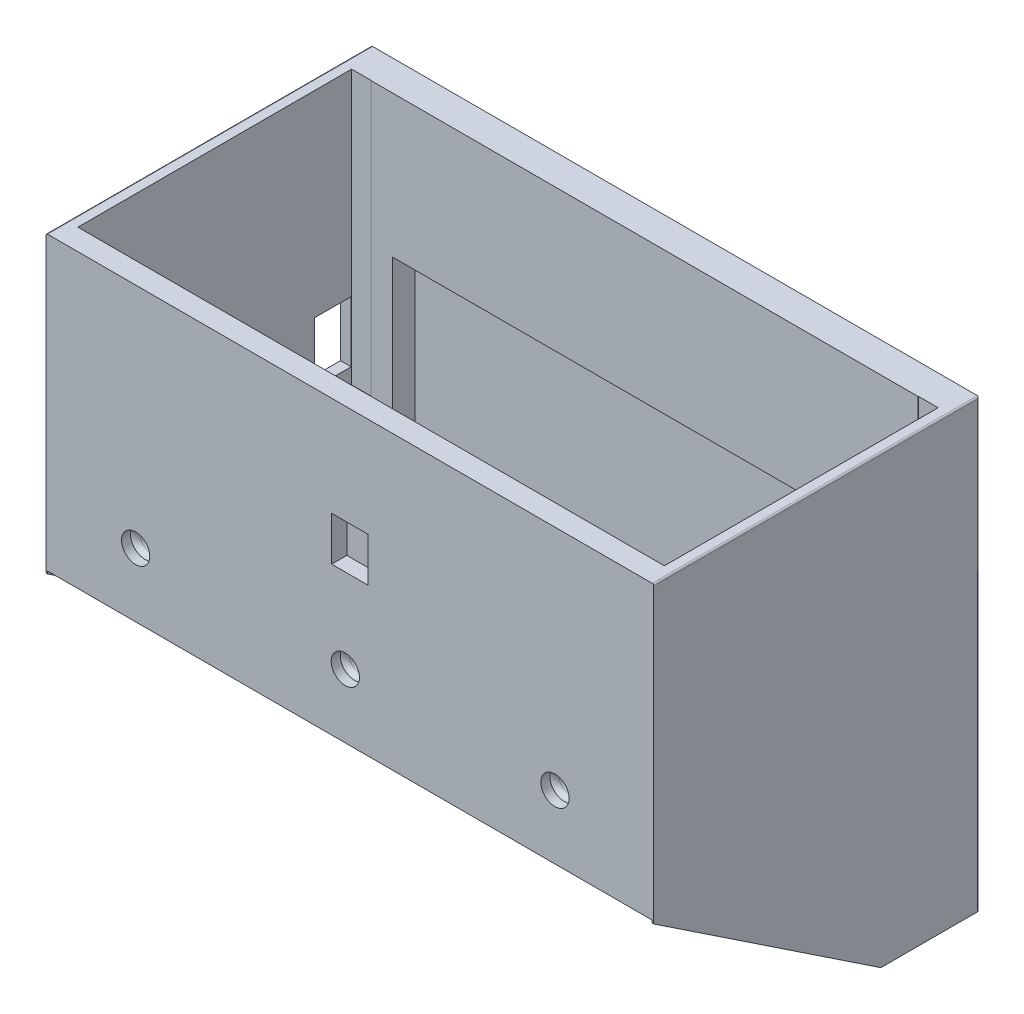
from build123d import *

# Parameters (mm, degrees)
SKETCH2_W           = 200
SKETCH2_H           = 150
BOSS_EXTRUDE1_DEPTH = 35
SKETCH3_W           = 200
SKETCH3_H           = 100
BOSS_EXTRUDE2_DEPTH = 75
LOFT3_START         = -100
LOFT3_DEPTH         = 200
SHELL2_T            = -10
SKETCH26_W          = 28.5
SKETCH26_H          = 31
CUT_EXTRUDE12_DEPTH = 15
SKETCH28_RX         = 8.1
SKETCH28_RY         = 7
CUT_EXTRUDE13_DEPTH = 9
SKETCH29_R          = 5
CUT_EXTRUDE14_DEPTH = 7.5
FILLET1_R           = 2
FILLET2_R           = 0.5
FILLET3_R           = 2
SKETCH30_R          = 1.75
CUT_EXTRUDE16_DEPTH = 10
SKETCH34_R          = 3.5
CUT_EXTRUDE18_DEPTH = 15
SKETCH34_3_R        = 4.65
SKETCH34_3_R_2      = 3.5
CUT_EXTRUDE19_DEPTH = 6
FILLET4_R           = 2
SKETCH35_W          = 166
SKETCH35_H          = 56.5
CUT_EXTRUDE20_DEPTH = 7.5
SKETCH6_W           = 30
SKETCH6_H           = 14
SKETCH6_H_2         = 7.591980562
SKETCH6_W_2         = 17
SKETCH6_H_3         = 9
CUT_EXTRUDE23_DEPTH = 15
CUT_EXTRUDE25_DEPTH = 8
SKETCH6_7_R         = 11
CUT_EXTRUDE26_DEPTH = 7.5
SKETCH6_8_W         = 30
SKETCH6_8_H         = 22.408019438
CUT_EXTRUDE27_DEPTH = 7
SKETCH6_9_W         = 17
SKETCH6_9_H         = 12
CUT_EXTRUDE28_DEPTH = 7
SKETCH6_10_W        = 12
SKETCH6_10_H        = 3.25
CUT_EXTRUDE29_DEPTH = 15
SKETCH46_W          = 12
SKETCH46_H          = 10.75
CUT_EXTRUDE31_DEPTH = 8
SKETCH46_5_W        = 12
SKETCH46_5_H        = 3.75
CUT_EXTRUDE32_DEPTH = 15
SKETCH47_W          = 12
SKETCH47_H          = 20
CUT_EXTRUDE33_DEPTH = 15
SKETCH49_W          = 199
SKETCH49_H          = 89.265638732
CUT_EXTRUDE34_DEPTH = 5
SKETCH56_W          = 199
SKETCH56_H          = 33.894448725
CUT_EXTRUDE37_DEPTH = 3
SKETCH48_W          = 28.075612318
SKETCH48_H          = 16
CUT_EXTRUDE38_DEPTH = 3
SKETCH57_W          = 6.5
SKETCH57_H          = 90.087623696
CUT_EXTRUDE39_DEPTH = 90
SKETCH69_W          = 228.232533895
SKETCH69_H          = 6
CUT_EXTRUDE44_DEPTH = 150
CUT_EXTRUDE46_DEPTH = 239.901653406
SKETCH72_W          = 67.134585738
SKETCH72_H          = 6.170384585
CUT_EXTRUDE48_DEPTH = 239.901653406


# Read off the part's stored shape, not the designer's step: Loft3
with BuildPart() as part:
    # Sketch2 → Boss-Extrude1 (new body)
    with BuildSketch(Plane.XY):
        Rectangle(SKETCH2_W, SKETCH2_H)
    extrude(amount=BOSS_EXTRUDE1_DEPTH)

    # Sketch3 → Boss-Extrude2 (add)
    with BuildSketch(Plane.XY.offset(35)):
        with Locations((0, 25)):
            Rectangle(SKETCH3_W, SKETCH3_H)
    extrude(amount=BOSS_EXTRUDE2_DEPTH)

    # Loft3 outline → Loft3 (add)
    with BuildSketch(Plane.YZ.offset(LOFT3_START)):
        Polygon((-25, 110), (-75, 35), (-25, 35), align=None)
    extrude(amount=LOFT3_DEPTH)

    # Shell2
    shell2_openings = [part.faces().sort_by_distance(p)[0] for p in [
        (0, 75, 55),
    ]]
    offset(amount=SHELL2_T, openings=shell2_openings, kind=Kind.INTERSECTION)

    # Sketch26 → Cut-Extrude12 (cut)
    with BuildSketch(Plane.XZ.offset(75)):
        with Locations((0, 17.5)):
            Rectangle(SKETCH26_W, SKETCH26_H)
    extrude(amount=-CUT_EXTRUDE12_DEPTH, mode=Mode.SUBTRACT)

    # Sketch28 → Cut-Extrude13 (cut)
    with BuildSketch(Plane.XZ.offset(75)):
        with Locations(Location((14.25, 17.25), (0, 0, -180))):
            Ellipse(SKETCH28_RX, SKETCH28_RY)
        with Locations(Location((-14.25, 17.25), (0, 0, -180))):
            Ellipse(SKETCH28_RX, SKETCH28_RY)
    extrude(amount=-CUT_EXTRUDE13_DEPTH, mode=Mode.SUBTRACT)

    # Sketch29 → Cut-Extrude14 (cut)
    with BuildSketch(Plane.XZ.offset(60)):
        with Locations((0, 10)):
            Circle(SKETCH29_R)
    extrude(amount=-CUT_EXTRUDE14_DEPTH, mode=Mode.SUBTRACT)

    # Fillet1
    fillet1_edges = [part.edges().sort_by_distance(p)[0] for p in [
        (0, -60, 5),
        (0, -52.5, 10),
    ]]
    fillet(fillet1_edges, radius=FILLET1_R)

    # Fillet2
    fillet2_edges = [part.edges().sort_by_distance(p)[0] for p in [
        (-100, 25, 110),
        (0, -25, 110),
        (100, 25, 110),
        (0, 75, 110),
        (100, -50, 72.5),
        (-100, -50, 72.5),
        (-100, 0, 0),
        (100, 0, 0),
        (100, -75, 17.5),
        (-100, -75, 17.5),
        (-100, 75, 55),
        (100, 75, 55),
    ]]
    fillet(fillet2_edges, radius=FILLET2_R)

    # Fillet3
    # the kernel refuses this fillet: 2 mm, written as the material it takes off along each edge
    with BuildSketch(Plane(origin=(-100, -73, 34.394448725), x_dir=(0, -1, 0), z_dir=(0, 0, -1))) as fillet3_piece_1:
        with BuildLine():
            CenterArc((1.5, -0.5), 0.5, 0, 90)
            Line((2, -0.5), (2, 0))
            Line((2, 0), (1.5, 0))
        make_face()
    revolve(axis=Axis((-100, -73, 34.394448725), (-1, 0, 0)), revolution_arc=33.690067526, mode=Mode.SUBTRACT)
    with BuildSketch(Plane(origin=(100, -73, 34.394448725), x_dir=(0, -0.8320502943378437, 0.5547001962252291), z_dir=(0, 0.5547001962252291, 0.8320502943378437))) as fillet3_piece_2:
        with BuildLine():
            CenterArc((1.5, -0.5), 0.5, 0, 90)
            Line((2, -0.5), (2, 0))
            Line((2, 0), (1.5, 0))
        make_face()
    revolve(axis=Axis((100, -73, 34.394448725), (1, 0, 0)), revolution_arc=33.690067526, mode=Mode.SUBTRACT)
    with BuildSketch(Plane(origin=(100, -75, 35), x_dir=(0, 0, -1), z_dir=(-1, 0, 0))) as fillet3_piece_3:
        with BuildLine():
            CenterArc((FILLET3_R * 0.302775637732, -FILLET3_R), FILLET3_R, 90, 33.690067526)
            Line((-FILLET3_R * 0.251924558493, -FILLET3_R * 0.167949705662), (0, 0))
            Line((0, 0), (FILLET3_R * 0.302775637732, 0))
        make_face()
    extrude(amount=200, mode=Mode.SUBTRACT)

    # Sketch30 → Cut-Extrude16 (cut)
    with BuildSketch(Plane.XZ.offset(66)):
        with Locations(Location((19.35, 17.25, 0), (0, 0, 270))):
            Circle(SKETCH30_R)
        with Locations(Location((-19.35, 17.25, 0), (0, 0, 270))):
            Circle(SKETCH30_R)
    extrude(amount=-CUT_EXTRUDE16_DEPTH, mode=Mode.SUBTRACT)

    # Sketch34 → Cut-Extrude18 (cut)
    with BuildSketch(Plane.XY.offset(110)):
        with Locations((-70.5, 0)):
            Circle(SKETCH34_R)
        with Locations((-1.5, 0)):
            Circle(SKETCH34_R)
        with Locations((67.5, 0)):
            Circle(SKETCH34_R)
    extrude(amount=-CUT_EXTRUDE18_DEPTH, mode=Mode.SUBTRACT)

    # Sketch34<3> → Cut-Extrude19 (cut)
    # profile 1 of 3: a face of its own
    with BuildSketch(Plane.XY.offset(110)):
        with Locations((-70.5, 0)):
            Circle(SKETCH34_3_R)
        with Locations((-70.5, 0)):
            Circle(SKETCH34_3_R_2, mode=Mode.SUBTRACT)
    # profile 2 of 3: a face of its own
    with BuildSketch(Plane.XY.offset(110)):
        with Locations((-1.5, 0)):
            Circle(SKETCH34_3_R)
        with Locations((-1.5, 0)):
            Circle(SKETCH34_3_R_2, mode=Mode.SUBTRACT)
    # profile 3 of 3: a face of its own
    with BuildSketch(Plane.XY.offset(110)):
        with Locations((67.5, 0)):
            Circle(SKETCH34_3_R)
        with Locations((67.5, 0)):
            Circle(SKETCH34_3_R_2, mode=Mode.SUBTRACT)
    extrude(amount=-CUT_EXTRUDE19_DEPTH, mode=Mode.SUBTRACT)

    # Fillet4
    # the kernel refuses this fillet: 2 mm, written as the material it takes off along each edge
    with BuildSketch(Plane(origin=(-70.5, 0, 104), x_dir=(1, 0, 0), z_dir=(0, -1, 0))) as fillet4_piece_1:
        with BuildLine():
            CenterArc((5.5, -1.810386699), FILLET4_R, 115.150663413, 64.849336587)
            Line((4.65, 0), (4.633, 0.036207734))
            ThreePointArc((4.633, 0.036207734), (4.075, 0.04), (3.5, 0.04))
            Line((3.5, 0.04), (3.46, 0))
            Line((3.46, 0), (3.46, -1.810386699))
            Line((3.46, -1.810386699), (3.5, -1.810386699))
        make_face()
    revolve(axis=Axis((-70.5, 0, 104), (0, 0, 1)), mode=Mode.SUBTRACT)
    with BuildSketch(Plane(origin=(-1.5, 0, 104), x_dir=(1, 0, 0), z_dir=(0, -1, 0))) as fillet4_piece_2:
        with BuildLine():
            CenterArc((5.5, -1.810386699), FILLET4_R, 115.150663413, 64.849336587)
            Line((4.65, 0), (4.633, 0.036207734))
            ThreePointArc((4.633, 0.036207734), (4.075, 0.04), (3.5, 0.04))
            Line((3.5, 0.04), (3.46, 0))
            Line((3.46, 0), (3.46, -1.810386699))
            Line((3.46, -1.810386699), (3.5, -1.810386699))
        make_face()
    revolve(axis=Axis((-1.5, 0, 104), (0, 0, 1)), mode=Mode.SUBTRACT)
    with BuildSketch(Plane(origin=(67.5, 0, 104), x_dir=(1, 0, 0), z_dir=(0, -1, 0))) as fillet4_piece_3:
        with BuildLine():
            CenterArc((5.5, -1.810386699), FILLET4_R, 115.150663413, 64.849336587)
            Line((4.65, 0), (4.633, 0.036207734))
            ThreePointArc((4.633, 0.036207734), (4.075, 0.04), (3.5, 0.04))
            Line((3.5, 0.04), (3.46, 0))
            Line((3.46, 0), (3.46, -1.810386699))
            Line((3.46, -1.810386699), (3.5, -1.810386699))
        make_face()
    revolve(axis=Axis((67.5, 0, 104), (0, 0, 1)), mode=Mode.SUBTRACT)

    # Sketch35 → Cut-Extrude20 (cut)
    with BuildSketch(Plane.XY.offset(10)):
        Rectangle(SKETCH35_W, SKETCH35_H)
    extrude(amount=-CUT_EXTRUDE20_DEPTH, mode=Mode.SUBTRACT)

    # Sketch6 → Cut-Extrude23 (cut)
    with BuildSketch(Plane(origin=(0, -68.076923077, 45.384615385), x_dir=(1, 0, 0), z_dir=(0, -0.8320502943378438, 0.554700196225229))):
        with Locations((-10, 32.658027472)):
            Rectangle(SKETCH6_W, SKETCH6_H)
        with BuildLine():
            Line((-58.5, 48.40604322), (-58.5, 16.910011724))
            ThreePointArc((-58.5, 16.910011724), (-52.614661349, 23.826266605), (-50.5, 32.658027472))
            ThreePointArc((-50.5, 32.658027472), (-52.614661349, 41.489788338), (-58.5, 48.40604322))
        make_face()
        with BuildLine():
            ThreePointArc((-81.5, 48.40604322), (-89.5, 32.658027472), (-81.5, 16.910011724))
            Line((-81.5, 16.910011724), (-81.5, 48.40604322))
        make_face()
        with Locations((50, 43.862037191)):
            Rectangle(SKETCH6_W, SKETCH6_H_2)
        with Locations((81.47680337, 21.908027472)):
            Rectangle(SKETCH6_W_2, SKETCH6_H_3)
        with Locations((81.47680337, 42.908027472)):
            Rectangle(SKETCH6_W_2, SKETCH6_H_3)
    extrude(amount=-CUT_EXTRUDE23_DEPTH, mode=Mode.SUBTRACT)

    # Sketch6<6> → Cut-Extrude25 (cut)
    with BuildSketch(Plane(origin=(0, -68.076923077, 45.384615385), x_dir=(1, 0, 0), z_dir=(0, -0.8320502943378438, 0.554700196225229))):
        Polygon((-33, 42.908027472), (-33, 22.408027472), (13, 22.408027472), (13, 42.908027472), (-4, 42.908027472), (-4, 39.658027472), (5, 39.658027472), (5, 25.658027472), (-25, 25.658027472), (-25, 39.658027472), (-16, 39.658027472), (-16, 42.908027472), align=None)
    extrude(amount=-CUT_EXTRUDE25_DEPTH, mode=Mode.SUBTRACT)

    # Sketch6<7> → Cut-Extrude26 (cut)
    with BuildSketch(Plane(origin=(0, -68.076923077, 45.384615385), x_dir=(1, 0, 0), z_dir=(0, -0.8320502943378438, 0.554700196225229))):
        with BuildLine():
            Line((-81.5, 48.40604322), (-81.5, 16.910011724))
            ThreePointArc((-81.5, 16.910011724), (-70, 13.158027472), (-58.5, 16.910011724))
            Line((-58.5, 16.910011724), (-58.5, 48.40604322))
            ThreePointArc((-58.5, 48.40604322), (-70, 52.158027472), (-81.5, 48.40604322))
        make_face()
        with Locations(Location((-70, 32.658027472, 0), (0, 0, 270))):
            Circle(SKETCH6_7_R, mode=Mode.SUBTRACT)
    extrude(amount=-CUT_EXTRUDE26_DEPTH, mode=Mode.SUBTRACT)

    # Sketch6<8> → Cut-Extrude27 (cut)
    with BuildSketch(Plane(origin=(0, -68.076923077, 45.384615385), x_dir=(1, 0, 0), z_dir=(0, -0.8320502943378438, 0.554700196225229))):
        with Locations((50, 28.862037191)):
            Rectangle(SKETCH6_8_W, SKETCH6_8_H)
    extrude(amount=-CUT_EXTRUDE27_DEPTH, mode=Mode.SUBTRACT)

    # Sketch6<9> → Cut-Extrude28 (cut)
    with BuildSketch(Plane(origin=(0, -68.076923077, 45.384615385), x_dir=(1, 0, 0), z_dir=(0, -0.8320502943378438, 0.554700196225229))):
        with Locations((81.47680337, 32.408027472)):
            Rectangle(SKETCH6_9_W, SKETCH6_9_H)
    extrude(amount=-CUT_EXTRUDE28_DEPTH, mode=Mode.SUBTRACT)

    # Sketch6<10> → Cut-Extrude29 (cut)
    with BuildSketch(Plane(origin=(0, -68.076923077, 45.384615385), x_dir=(1, 0, 0), z_dir=(0, -0.8320502943378438, 0.554700196225229))):
        with Locations((-10, 41.283027472)):
            Rectangle(SKETCH6_10_W, SKETCH6_10_H)
    extrude(amount=-CUT_EXTRUDE29_DEPTH, mode=Mode.SUBTRACT)

    # Sketch46 → Cut-Extrude31 (cut)
    with BuildSketch(Plane.XY.offset(110)):
        with Locations((0, 33.083977923)):
            Rectangle(SKETCH46_W, SKETCH46_H)
    extrude(amount=-CUT_EXTRUDE31_DEPTH, mode=Mode.SUBTRACT)

    # Sketch46<5> → Cut-Extrude32 (cut)
    with BuildSketch(Plane.XY.offset(110)):
        with Locations((0, 40.333977923)):
            Rectangle(SKETCH46_5_W, SKETCH46_5_H)
    extrude(amount=-CUT_EXTRUDE32_DEPTH, mode=Mode.SUBTRACT)

    # Sketch47 → Cut-Extrude33 (cut)
    with BuildSketch(Plane(origin=(-90, 0, 0), x_dir=(0, 0, -1), z_dir=(1, 0, 0))):
        with Locations((-16.069616756, 0.25)):
            Rectangle(SKETCH47_W, SKETCH47_H)
    extrude(amount=-CUT_EXTRUDE33_DEPTH, mode=Mode.SUBTRACT)

    # Sketch49 → Cut-Extrude34 (cut)
    with BuildSketch(Plane(origin=(0, -68.076923077, 45.384615385), x_dir=(1, 0, 0), z_dir=(0, -0.8320502943378438, 0.554700196225229))):
        with Locations((0, 32.757616226)):
            Rectangle(SKETCH49_W, SKETCH49_H)
    extrude(amount=-CUT_EXTRUDE34_DEPTH, mode=Mode.SUBTRACT)

    # Sketch56 → Cut-Extrude37 (cut)
    with BuildSketch(Plane.XZ.offset(75)):
        with Locations((0, 17.447224363)):
            Rectangle(SKETCH56_W, SKETCH56_H)
    extrude(amount=-CUT_EXTRUDE37_DEPTH, mode=Mode.SUBTRACT)

    # Sketch48 → Cut-Extrude38 (cut)
    with BuildSketch(Plane(origin=(0, 0, 0), x_dir=(-1, 0, 0), z_dir=(0, 0, -1))):
        with Locations((0.015084374, -67)):
            Rectangle(SKETCH48_W, SKETCH48_H)
    extrude(amount=-CUT_EXTRUDE38_DEPTH, mode=Mode.SUBTRACT)

    # Sketch57 → Cut-Extrude39 (cut)
    with BuildSketch(Plane(origin=(0, 75, 0), x_dir=(1, 0, 0), z_dir=(0, 1, 0))):
        with Locations((-93.25, -54.956188152)):
            Rectangle(SKETCH57_W, SKETCH57_H)
        with Locations((93.25, -54.956188152)):
            Rectangle(SKETCH57_W, SKETCH57_H)
    extrude(amount=-CUT_EXTRUDE39_DEPTH, mode=Mode.SUBTRACT)

    # Sketch69 → Cut-Extrude44 (cut)
    with BuildSketch(Plane(origin=(0, 75, 0), x_dir=(1, 0, 0), z_dir=(0, 1, 0))):
        with Locations((-0.991143308, -110)):
            Rectangle(SKETCH69_W, SKETCH69_H)
    extrude(amount=-CUT_EXTRUDE44_DEPTH, mode=Mode.SUBTRACT)

    # Sketch70 → Cut-Extrude46 (cut, through all)
    with BuildSketch(Plane(origin=(100, 0, 0), x_dir=(0, 0, -1), z_dir=(1, 0, 0))):
        Polygon((42.008986785, -121.172364576), (-107.615249255, -21.422873882), (-112.384750745, -28.577126118), (37.239485295, -128.326616811), align=None)
    extrude(amount=-CUT_EXTRUDE46_DEPTH, mode=Mode.SUBTRACT)

    # Sketch72 → Cut-Extrude48 (cut, through all)
    with BuildSketch(Plane.ZY.offset(100)):
        with Locations((30.656869063, -74.744235043)):
            Rectangle(SKETCH72_W, SKETCH72_H)
    extrude(amount=-CUT_EXTRUDE48_DEPTH, mode=Mode.SUBTRACT)


solid = part.part
